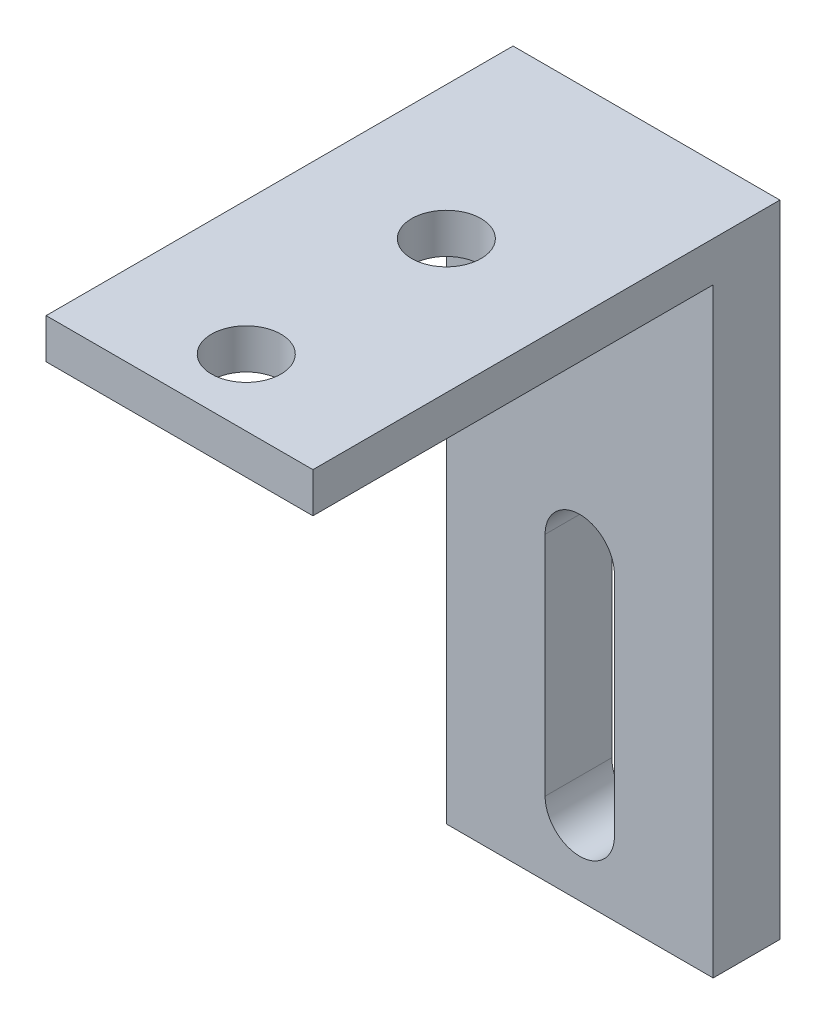
from build123d import *

# Parameters (mm, degrees)
SKETCH1_W           = 20
SKETCH1_H           = 20
SKETCH1_R           = 2.6
BOSS_EXTRUDE2_DEPTH = 3
SKETCH2_W           = 20
SKETCH2_H           = 3
BOSS_EXTRUDE3_DEPTH = 10
CUT_EXTRUDE1_DEPTH  = 10
SKETCH6_W           = 20
SKETCH6_H           = 3
BOSS_EXTRUDE5_DEPTH = 5
SKETCH7_W           = 20
SKETCH7_H           = 5
BOSS_EXTRUDE6_DEPTH = 45
CUT_EXTRUDE2_DEPTH  = 5


with BuildPart() as part:
    # Sketch1 → Boss-Extrude2 (new body)
    with BuildSketch(Plane(origin=(0, 0, 0), x_dir=(1, 0, 0), z_dir=(0, 1, 0))):
        Rectangle(SKETCH1_W, SKETCH1_H)
        Circle(SKETCH1_R, mode=Mode.SUBTRACT)
    extrude(amount=BOSS_EXTRUDE2_DEPTH)

    # Sketch2 → Boss-Extrude3 (add)
    with BuildSketch(Plane.XY.offset(10)):
        with Locations((0, 1.5)):
            Rectangle(SKETCH2_W, SKETCH2_H)
    extrude(amount=BOSS_EXTRUDE3_DEPTH)

    # Sketch4 → Cut-Extrude1 (cut)
    with BuildSketch(Plane(origin=(0, 3, 0), x_dir=(1, 0, 0), z_dir=(0, 1, 0))):
        with BuildLine():
            ThreePointArc((0, -12.4), (-1.838477631, -16.838477631), (2.6, -15))
            ThreePointArc((2.6, -15), (1.838477631, -13.161522369), (0, -12.4))
        make_face()
    extrude(amount=-CUT_EXTRUDE1_DEPTH, mode=Mode.SUBTRACT)

    # Sketch6 → Boss-Extrude5 (add)
    with BuildSketch(Plane(origin=(0, 0, -10), x_dir=(-1, 0, 0), z_dir=(0, 0, -1))):
        with Locations((0, 1.5)):
            Rectangle(SKETCH6_W, SKETCH6_H)
    extrude(amount=BOSS_EXTRUDE5_DEPTH)

    # Sketch7 → Boss-Extrude6 (add)
    with BuildSketch(Plane.XZ):
        with Locations((0, -12.5)):
            Rectangle(SKETCH7_W, SKETCH7_H)
    extrude(amount=BOSS_EXTRUDE6_DEPTH)

    # Sketch8 → Cut-Extrude2 (cut)
    with BuildSketch(Plane(origin=(0, 0, -15), x_dir=(-1, 0, 0), z_dir=(0, 0, -1))):
        with BuildLine():
            Line((-2.6, -22.5), (-2.6, -39.5))
            ThreePointArc((-2.6, -39.5), (0, -42.1), (2.6, -39.5))
            Line((2.6, -39.5), (2.6, -22.5))
            ThreePointArc((2.6, -22.5), (0, -19.9), (-2.6, -22.5))
        make_face()
    extrude(amount=-CUT_EXTRUDE2_DEPTH, mode=Mode.SUBTRACT)


solid = part.part
